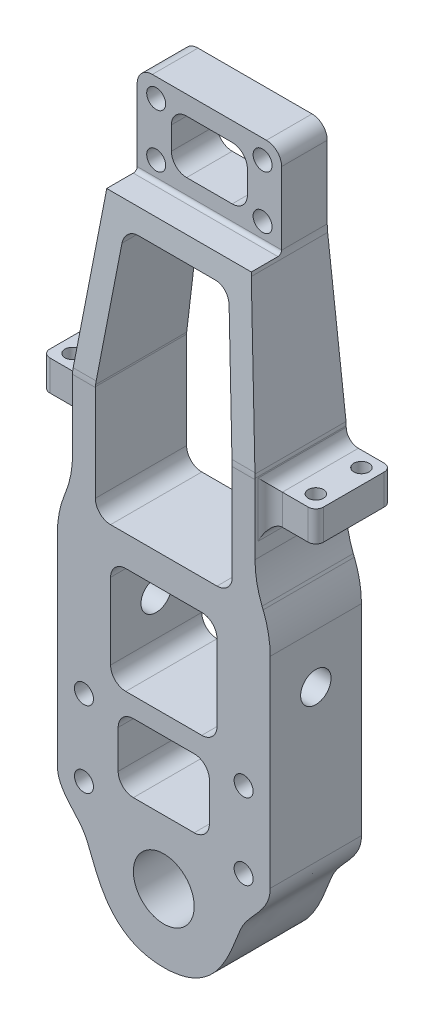
from build123d import *

# Parameters (mm, degrees)
SKETCH1_R               = 12.7
SKETCH1_W               = 44.45
SKETCH1_H               = 44.45
BOSS_EXTRUDE1_DEPTH     = 38.1
FILLET13_R              = 25.4
CUT_EXTRUDE1_DEPTH      = 196.042232104
CUT_EXTRUDE1_DEPTH_BACK = 196.042232104
SKETCH2_W               = 19.05
SKETCH2_H               = 38.1
SKETCH3_R               = 3.96875
CUT_EXTRUDE2_DEPTH      = 193.23101936
CUT_EXTRUDE3_DEPTH      = 201.571602998
CUT_EXTRUDE3_DEPTH_BACK = 201.571602998
SKETCH4_R               = 6.35
BOSS_EXTRUDE2_DEPTH     = 38.1
CUT_EXTRUDE4_DEPTH      = 203.572006775
CUT_EXTRUDE4_DEPTH_BACK = 203.572006775
SKETCH6_R               = 6.35
SKETCH7_W               = 38.1
SKETCH7_H               = 28.575
CUT_EXTRUDE5_DEPTH      = 33.3375
CUT_EXTRUDE13_DEPTH     = 197.381426831
FILLET1_R               = 6.35
FILLET5_R               = 41.275
SKETCH14_R              = 3.96875
CUT_EXTRUDE9_DEPTH      = 19.05
FILLET4_R               = 6.35
SKETCH15_W              = 31.75
SKETCH15_H              = 12.7
BOSS_EXTRUDE3_DEPTH     = 19.05
CUT_EXTRUDE10_REACH     = 204.385
SKETCH16_R              = 3.175
FILLET11_R              = 12.7
FILLET6_R               = 5.08
FILLET7_R               = 5.08
FILLET8_R               = 3.175
CHAMFER1_SIZE           = 66.802
CHAMFER1_SIZE_2         = 6.35
FILLET9_R               = 25.4
FILLET10_R              = 1.5875
CUT_EXTRUDE11_DEPTH     = 200.639637376
FILLET14_R              = 6.35
SKETCH19_W              = 31.75
SKETCH19_H              = 22.225
CUT_EXTRUDE12_DEPTH     = 197.894076461
FILLET15_R              = 6.35
FILLET16_R              = 1.5875


with BuildPart() as part:
    # Sketch1 → Boss-Extrude1 (new body)
    with BuildSketch(Plane.XY):
        Polygon((-38.1, -114.173), (38.1, -114.173), (38.1, 82.55), (30.1625, 149.352), (30.1625, 187.452), (-30.1625, 187.452), (-30.1625, 149.352), (-38.1, 82.55), align=None)
        with Locations(Location((0, -85.725, 0), (0, 0, 180))):
            Circle(SKETCH1_R, mode=Mode.SUBTRACT)
        Rectangle(SKETCH1_W, SKETCH1_H, mode=Mode.SUBTRACT)
    extrude(amount=BOSS_EXTRUDE1_DEPTH)

    # Fillet13
    fillet13_edges = [part.edges().sort_by_distance(p)[0] for p in [
        (-30.1625, 149.352, 19.05),
        (30.1625, 149.352, 19.05),
    ]]
    fillet(fillet13_edges, radius=FILLET13_R)

    # Sketch2 → Cut-Extrude1 (cut, two sides: drawn at the far end of the back side and taken through both)
    with BuildSketch(Plane(origin=(0, 0, 0), x_dir=(0, 0, -1), z_dir=(1, 0, 0)).offset(-CUT_EXTRUDE1_DEPTH_BACK)):
        with Locations((-28.575, 168.402)):
            Rectangle(SKETCH2_W, SKETCH2_H)
    extrude(amount=CUT_EXTRUDE1_DEPTH + CUT_EXTRUDE1_DEPTH_BACK, mode=Mode.SUBTRACT)

    # Sketch3 → Cut-Extrude2 (cut, through all)
    with BuildSketch(Plane.XY.offset(19.05)):
        with Locations((-22.225, 179.5145)):
            Circle(SKETCH3_R)
        with Locations((22.225, 179.5145)):
            Circle(SKETCH3_R)
        with Locations((-22.225, 157.2895)):
            Circle(SKETCH3_R)
        with Locations((22.225, 157.2895)):
            Circle(SKETCH3_R)
    extrude(amount=-CUT_EXTRUDE2_DEPTH, mode=Mode.SUBTRACT)

    # Sketch4 → Cut-Extrude3 (cut, two sides: drawn at the far end of the back side and taken through both)
    with BuildSketch(Plane(origin=(-22.225, 0, 0), x_dir=(0, 0, -1), z_dir=(1, 0, 0)).offset(-CUT_EXTRUDE3_DEPTH_BACK)):
        with Locations(Location((-19.05, 0, 0), (0, 0, 90))):
            Circle(SKETCH4_R)
    extrude(amount=CUT_EXTRUDE3_DEPTH + CUT_EXTRUDE3_DEPTH_BACK, mode=Mode.SUBTRACT)

    # Sketch5 → Boss-Extrude2 (add)
    with BuildSketch(Plane.XY.offset(38.1)):
        Polygon((-44.45, -114.173), (-38.1, -114.173), (-38.1, 44.45), (-44.45, 28.575), align=None)
        Polygon((38.1, 44.45), (38.1, -114.173), (44.45, -114.173), (44.45, 28.575), align=None)
    extrude(amount=-BOSS_EXTRUDE2_DEPTH)

    # Sketch6 → Cut-Extrude4 (cut, two sides: drawn at the far end of the back side and taken through both)
    with BuildSketch(Plane(origin=(-22.225, 0, 0), x_dir=(0, 0, -1), z_dir=(1, 0, 0)).offset(-CUT_EXTRUDE4_DEPTH_BACK)):
        with Locations((-19.05, 0)):
            Circle(SKETCH6_R)
    extrude(amount=CUT_EXTRUDE4_DEPTH + CUT_EXTRUDE4_DEPTH_BACK, mode=Mode.SUBTRACT)

    # Sketch7 → Cut-Extrude5 (cut)
    with BuildSketch(Plane.XY.offset(38.1)):
        with Locations((0, -44.7675)):
            Rectangle(SKETCH7_W, SKETCH7_H)
    extrude(amount=-CUT_EXTRUDE5_DEPTH, mode=Mode.SUBTRACT)

    # Sketch20 → Cut-Extrude13 (cut, through all)
    with BuildSketch(Plane.XY.offset(38.1)):
        Polygon((-28.575, 81.986096983), (-21.702269128, 139.827), (21.702269128, 139.827), (28.575, 81.986096983), (28.575, 34.925), (-28.575, 34.925), align=None)
    extrude(amount=-CUT_EXTRUDE13_DEPTH, mode=Mode.SUBTRACT)

    # Fillet1
    fillet1_edges = [part.edges().sort_by_distance(p)[0] for p in [
        (19.05, -59.055, 21.43125),
        (19.05, -30.48, 21.43125),
        (-19.05, -30.48, 21.43125),
        (-19.05, -59.055, 21.43125),
        (-28.575, 34.925, 19.05),
        (28.575, 34.925, 19.05),
        (28.575, 81.986096983, 19.05),
        (21.702269128, 139.827, 19.05),
        (-28.575, 81.986096983, 19.05),
        (-21.702269128, 139.827, 19.05),
    ]]
    fillet(fillet1_edges, radius=FILLET1_R)

    # Fillet5
    fillet5_edges = [part.edges().sort_by_distance(p)[0] for p in [
        (44.45, 28.575, 19.05),
        (-44.45, 28.575, 19.05),
        (-38.1, 44.45, 19.05),
        (38.1, 44.45, 19.05),
    ]]
    fillet(fillet5_edges, radius=FILLET5_R)

    # Sketch14 → Cut-Extrude9 (cut)
    with BuildSketch(Plane.XY.offset(38.1)):
        with Locations((33.3375, -31.75)):
            Circle(SKETCH14_R)
        with Locations((33.3375, -63.5)):
            Circle(SKETCH14_R)
        with Locations((-33.3375, -63.5)):
            Circle(SKETCH14_R)
        with Locations((-33.3375, -31.75)):
            Circle(SKETCH14_R)
    extrude(amount=-CUT_EXTRUDE9_DEPTH, mode=Mode.SUBTRACT)

    # Fillet4
    fillet4_edges = [part.edges().sort_by_distance(p)[0] for p in [
        (-22.225, 22.225, 19.05),
        (-22.225, -22.225, 19.05),
        (22.225, -22.225, 19.05),
        (22.225, 22.225, 19.05),
    ]]
    fillet(fillet4_edges, radius=FILLET4_R)

    # Sketch15 → Boss-Extrude3 (add)
    with BuildSketch(Plane(origin=(38.1, 0, 0), x_dir=(0, 0, -1), z_dir=(1, 0, 0))):
        with Locations((-15.875, 69.85)):
            Rectangle(SKETCH15_W, SKETCH15_H)
    boss_extrude3 = extrude(amount=BOSS_EXTRUDE3_DEPTH)

    # Sketch16 → Cut-Extrude10 (cut, up to next)
    with BuildSketch(Plane(origin=(0, 76.2, 0), x_dir=(1, 0, 0), z_dir=(0, 1, 0)), mode=Mode.PRIVATE) as cut_extrude10_sk1:
        with Locations(Location((50.8, -6.35, 0), (0, 0, 180))):
            Circle(SKETCH16_R)
    cut_extrude10_tool1 = extrude(cut_extrude10_sk1.sketch, amount=-CUT_EXTRUDE10_REACH, mode=Mode.PRIVATE) & part.part
    # Sketch16 → Cut-Extrude10 (cut, up to next)
    with BuildSketch(Plane(origin=(0, 76.2, 0), x_dir=(1, 0, 0), z_dir=(0, 1, 0)), mode=Mode.PRIVATE) as cut_extrude10_sk2:
        with Locations(Location((50.8, -25.4, 0), (0, 0, 180))):
            Circle(SKETCH16_R)
    cut_extrude10_tool2 = extrude(cut_extrude10_sk2.sketch, amount=-CUT_EXTRUDE10_REACH, mode=Mode.PRIVATE) & part.part
    cut_extrude10_1 = cut_extrude10_tool1.solids().sort_by_distance((50.8, 76.2, 6.35))[0]
    add(cut_extrude10_1, mode=Mode.SUBTRACT)
    cut_extrude10_2 = cut_extrude10_tool2.solids().sort_by_distance((50.8, 76.2, 25.4))[0]
    add(cut_extrude10_2, mode=Mode.SUBTRACT)
    cut_extrude10 = cut_extrude10_1 + cut_extrude10_2  # Cut-Extrude10 as one shape, for the pattern or mirror that repeats it

    # Mirror4: Boss-Extrude3, Cut-Extrude10 across plane
    add(boss_extrude3.mirror(Plane(origin=(0, 0, 0), x_dir=(0, 0, 1), z_dir=(1, 0, 0))))
    add(cut_extrude10.mirror(Plane(origin=(0, 0, 0), x_dir=(0, 0, 1), z_dir=(1, 0, 0))), mode=Mode.SUBTRACT)

    # Fillet11
    fillet11_edges = [part.edges().sort_by_distance(p)[0] for p in [
        (-38.1, 82.55, 19.05),
        (38.1, 82.55, 19.05),
    ]]
    fillet(fillet11_edges, radius=FILLET11_R)

    # Fillet6
    fillet6_edges = [part.edges().sort_by_distance(p)[0] for p in [
        (-38.1, 76.2, 15.875),
        (-38.1, 63.5, 15.875),
        (38.1, 63.5, 15.875),
        (38.1, 76.2, 15.875),
    ]]
    fillet(fillet6_edges, radius=FILLET6_R)

    # Fillet7
    fillet7_edges = [part.edges().sort_by_distance(p)[0] for p in [
        (-38.1, 69.85, 31.75),
        (38.1, 69.85, 31.75),
    ]]
    fillet(fillet7_edges, radius=FILLET7_R)

    # Fillet8
    fillet8_edges = [part.edges().sort_by_distance(p)[0] for p in [
        (57.15, 69.85, 0),
        (57.15, 69.85, 31.75),
        (-57.15, 69.85, 0),
        (-57.15, 69.85, 31.75),
    ]]
    fillet(fillet8_edges, radius=FILLET8_R)

    # Chamfer1
    # the kernel refuses this chamfer: 66.802, 6.35 mm, written as the material it takes off along each edge
    with BuildSketch(Plane(origin=(203.86342462, 149.352, 38.1), x_dir=(0, -0.9999933743140121, 0.0036402373653618017), z_dir=(-1, 0, 0))) as chamfer1_piece_1:
        Polygon((CHAMFER1_SIZE * 0.999993374314, -CHAMFER1_SIZE * 0.00364023736536), (-CHAMFER1_SIZE_2 * 0.00364023736536, -CHAMFER1_SIZE_2 * 0.999993374314), (0, 0), align=None)
    extrude(amount=407.72684924, mode=Mode.SUBTRACT)

    # Fillet9
    # the kernel refuses this fillet: 25.4 mm, written as the material it takes off along each edge
    with BuildSketch(Plane(origin=(-25.496722527, 82.55, 38.1), x_dir=(0, -1, 0), z_dir=(-1, 0, 0)), Plane(origin=(41.088997971, 82.55, 38.1), x_dir=(0, -1, 0), z_dir=(-1, 0, 0))) as fillet9_piece_1:
        with BuildLine():
            CenterArc((FILLET9_R * 0.0474216344384, -FILLET9_R), FILLET9_R, 90, 5.430051073)
            Line((-FILLET9_R * 0.0472088283736, -FILLET9_R * 0.0044875312142), (0, 0))
            Line((0, 0), (FILLET9_R * 0.0474216344384, 0))
        make_face()
    extrude(amount=15.592275444, mode=Mode.SUBTRACT)

    # Fillet10
    fillet10_edges = [part.edges().sort_by_distance(p)[0] for p in [
        (19.05, -44.7675, 4.7625),
        (0, -59.055, 4.7625),
        (-19.05, -44.7675, 4.7625),
        (0, -30.48, 4.7625),
        (-17.190128061, -57.195128061, 4.7625),
        (-17.190128061, -32.339871939, 4.7625),
        (17.190128061, -32.339871939, 4.7625),
        (17.190128061, -57.195128061, 4.7625),
    ]]
    fillet(fillet10_edges, radius=FILLET10_R)

    # Sketch18 → Cut-Extrude11 (cut, through all)
    with BuildSketch(Plane.XY.offset(38.1)):
        with BuildLine():
            Line((-44.45, -63.289742151), (-44.45, -114.173))
            Line((-44.45, -114.173), (0, -114.173))
            add(Edge.make_bspline(
                [(-44.45, -63.289742151), (-44.45, -70.610860272), (-36.980452131, -76.229308613), (-28.923480483, -88.56724845), (-23.789830823, -114.173), (0, -114.173)],
                knots=[0, 0, 0, 0, 0.400028128, 0.500028128, 1, 1, 1, 1], degree=3))
        make_face()
        with BuildLine():
            add(Edge.make_bspline(
                [(44.45, -63.289742151), (44.45, -70.610860272), (36.980452131, -76.229308613), (28.923480483, -88.56724845), (23.789830823, -114.173), (0, -114.173)],
                knots=[0, 0, 0, 0, 0.400028128, 0.500028128, 1, 1, 1, 1], degree=3))
            Line((0, -114.173), (44.45, -114.173))
            Line((44.45, -114.173), (44.45, -63.289742151))
        make_face()
    extrude(amount=-CUT_EXTRUDE11_DEPTH, mode=Mode.SUBTRACT)

    # Fillet14
    fillet14_edges = [part.edges().sort_by_distance(p)[0] for p in [
        (-30.1625, 187.452, 9.525),
        (30.1625, 187.452, 9.525),
    ]]
    fillet(fillet14_edges, radius=FILLET14_R)

    # Sketch19 → Cut-Extrude12 (cut, through all)
    with BuildSketch(Plane.XY.offset(19.05)):
        with Locations((0, 168.402)):
            Rectangle(SKETCH19_W, SKETCH19_H)
    extrude(amount=-CUT_EXTRUDE12_DEPTH, mode=Mode.SUBTRACT)

    # Fillet15
    fillet15_edges = [part.edges().sort_by_distance(p)[0] for p in [
        (15.875, 179.5145, 9.525),
        (15.875, 157.2895, 9.525),
        (-15.875, 157.2895, 9.525),
        (-15.875, 179.5145, 9.525),
    ]]
    fillet(fillet15_edges, radius=FILLET15_R)

    # Fillet16
    fillet16_edges = [part.edges().sort_by_distance(p)[0] for p in [
        (0, 149.352, 19.05),
    ]]
    fillet(fillet16_edges, radius=FILLET16_R)


solid = part.part
